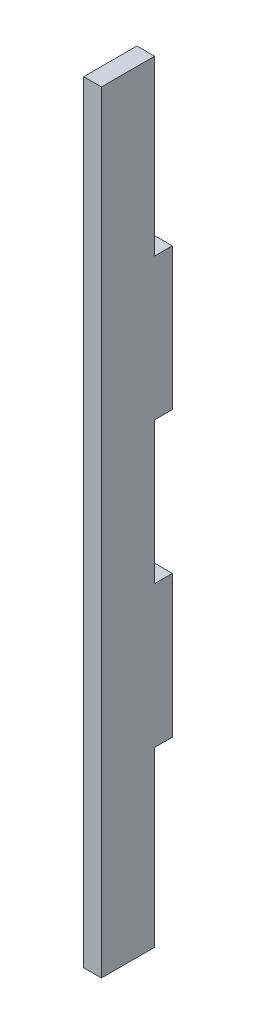
from build123d import *

# Parameters (mm, degrees)
SKETCH1_W           = 9.525
SKETCH1_H           = 5.588
BOSS_EXTRUDE1_DEPTH = 3.175


with BuildPart() as part:
    # Sketch1 → Boss-Extrude1 (new body)
    with BuildSketch(Plane(origin=(0, 0, 0), x_dir=(0, 0, -1), z_dir=(1, 0, 0))):
        Polygon((-6.35, 0), (-6.35, -132.588), (3.175, -132.588), (3.175, -127), (3.175, -101.6), (6.35, -101.6), (6.35, -76.2), (3.175, -76.2), (3.175, -50.8), (6.35, -50.8), (6.35, -25.4), (3.175, -25.4), (3.175, 0), align=None)
        with Locations((-1.5875, 2.794)):
            Rectangle(SKETCH1_W, SKETCH1_H)
    extrude(amount=BOSS_EXTRUDE1_DEPTH)


solid = part.part
